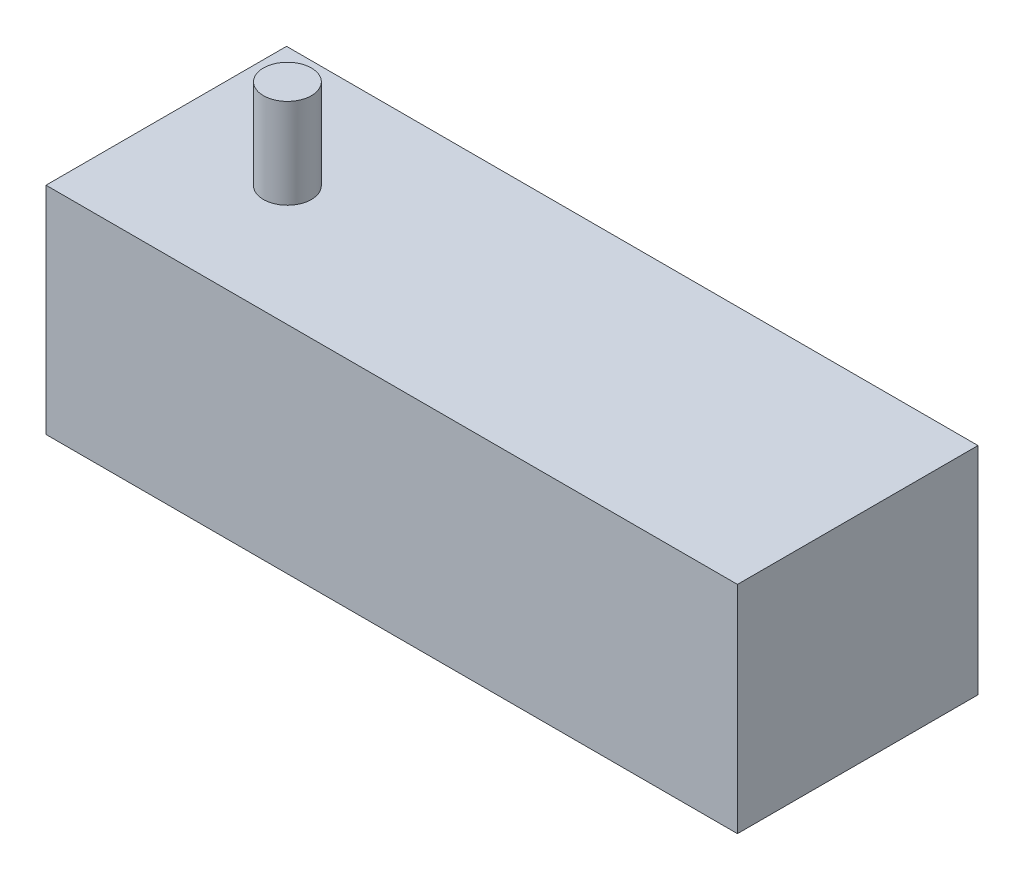
from build123d import *

# Parameters (mm, degrees)
SKETCH1_W           = 115.3
SKETCH1_H           = 40.11
BOSS_EXTRUDE1_DEPTH = 36
SKETCH2_R           = 4
BOSS_EXTRUDE2_DEPTH = 15


with BuildPart() as part:
    # Sketch1 → Boss-Extrude1 (new body)
    with BuildSketch(Plane(origin=(0, 0, 0), x_dir=(1, 0, 0), z_dir=(0, 1, 0))):
        with Locations((57.65, 20.055)):
            Rectangle(SKETCH1_W, SKETCH1_H)
    extrude(amount=BOSS_EXTRUDE1_DEPTH)

    # Sketch2 → Boss-Extrude2 (add)
    with BuildSketch(Plane(origin=(0, 36, 0), x_dir=(1, 0, 0), z_dir=(0, 1, 0))):
        with Locations((20.2, 20.055)):
            Circle(SKETCH2_R)
    extrude(amount=BOSS_EXTRUDE2_DEPTH)


solid = part.part
